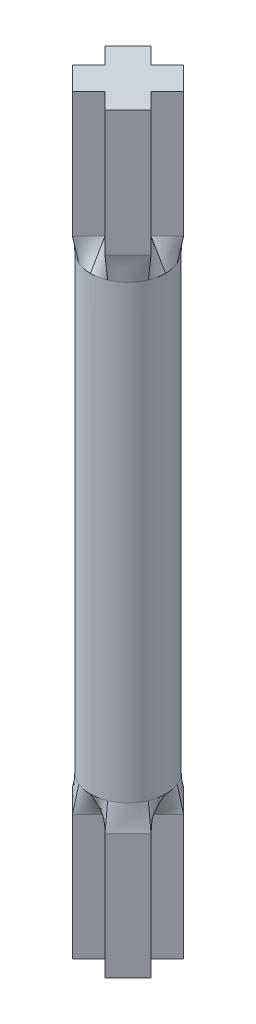
from build123d import *

# Parameters (mm, degrees)
BOSS_EXTRUDE1_DEPTH = 13.804347826
SCALE1_SCALE        = 0.92
SKETCH2_R           = 3.81
SKETCH3_R           = 3.81
BOSS_EXTRUDE2_DEPTH = 22.86
BOSS_EXTRUDE4_DEPTH = 13.804347826
SCALE2_SCALE        = 0.92


with BuildPart() as part:
    # Sketch1 → Boss-Extrude1 (new body)
    with BuildSketch(Plane(origin=(0, 0, 0), x_dir=(1, 0, 0), z_dir=(0, 1, 0))):
        Polygon((-0.6269783, 2.91618698), (-2.423029524, 4.712238204), (-4.963029524, 2.172238204), (-3.1669783, 0.37618698), (-4.963029524, -1.419864244), (-2.423029524, -3.959864244), (-0.6269783, -2.16381302), (1.169072924, -3.959864244), (3.709072924, -1.419864244), (1.9130217, 0.37618698), (3.709072924, 2.172238204), (1.169072924, 4.712238204), align=None)
    extrude(amount=BOSS_EXTRUDE1_DEPTH)


with BuildPart() as part_1:
    # Scale1: scaled about (-0.6269783, 6.902173913, -0.37618698)
    add(part.part.scale(SCALE1_SCALE).moved(Location((-0.050158264, 0.552173913, -0.030094958))))

    # Sketch2 → section 1 of loft1
    with BuildSketch(Plane(origin=(0, 15.792173913, 0), x_dir=(1, 0, 0), z_dir=(0, 1, 0)), mode=Mode.PRIVATE) as loft1_s1:
        with Locations((-0.6269783, 0.37618698)):
            Circle(SKETCH2_R)
    # loft from a face of the part (loft1)
    loft([part_1.faces().sort_by_distance((-0.6269783, 13.252173913, -0.37618698))[0], loft1_s1.sketch])

    # Sketch3 → Boss-Extrude2 (add)
    with BuildSketch(Plane(origin=(0, 15.792173913, 0), x_dir=(1, 0, 0), z_dir=(0, 1, 0))):
        with Locations((-0.6269783, 0.37618698)):
            Circle(SKETCH3_R)
    boss_extrude2 = extrude(amount=BOSS_EXTRUDE2_DEPTH)

    # Mirror6: Boss-Extrude2 across plane
    add(boss_extrude2.mirror(Plane(origin=(-0.6269783, 38.652173913, -0.37618698), x_dir=(0, 0, 1), z_dir=(0, 1, 0))))



with BuildPart() as body_2:
    # Sketch5 → Boss-Extrude4 (new body)
    with BuildSketch(Plane(origin=(0, 63.500993913, 0), x_dir=(1, 0, 0), z_dir=(0, 1, 0))):
        Polygon((-0.6269783, 2.91618698), (-2.423029524, 4.712238204), (-4.963029524, 2.172238204), (-3.1669783, 0.37618698), (-4.963029524, -1.419864244), (-2.423029524, -3.959864244), (-0.6269783, -2.16381302), (1.169072924, -3.959864244), (3.709072924, -1.419864244), (1.9130217, 0.37618698), (3.709072924, 2.172238204), (1.169072924, 4.712238204), align=None)
    extrude(amount=BOSS_EXTRUDE4_DEPTH)


with BuildPart() as body_2_1:
    # Scale2: scaled about (-0.6269783, 70.403167826, -0.37618698)
    add(body_2.part.scale(SCALE2_SCALE).moved(Location((-0.050158264, 5.632253426, -0.030094958))))


with BuildPart() as part_2:
    add(part_1.part)

    add(body_2_1.part)  # loft2 joins it to this body
    # loft from a face of the part (loft2)
    loft([part_2.faces().sort_by_distance((-0.6269783, 61.512173913, -0.37618698))[0], part_2.faces().sort_by_distance((-0.6269783, 64.053167826, -0.37618698))[0]])


solid = part_2.part
